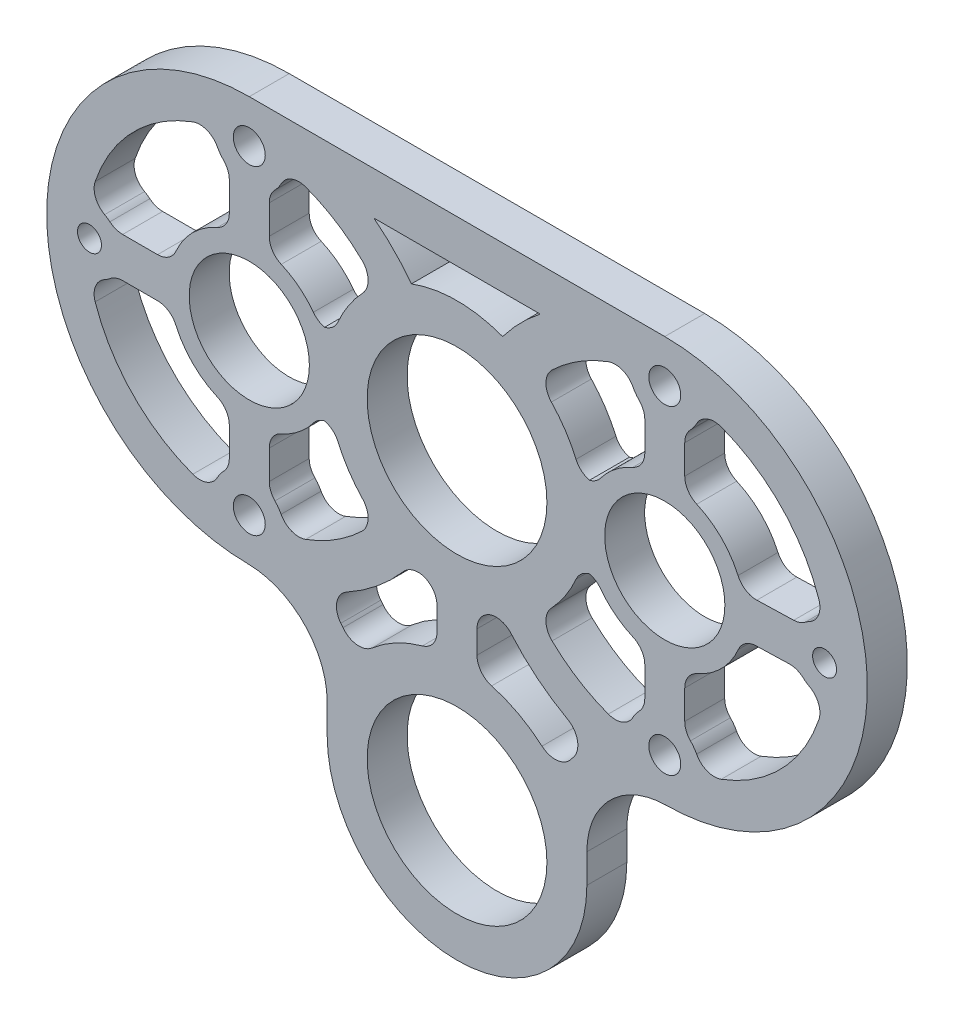
from build123d import *

# Parameters (mm, degrees)
SKETCH1_R           = 9.5504
SKETCH1_R_2         = 2.54
SKETCH1_R_3         = 14.2875
SKETCH1_R_4         = 1.905
BOSS_EXTRUDE1_DEPTH = 6.35
FILLET1_R           = 3.175
FILLET2_R           = 3.175


with BuildPart() as part:
    # Sketch1 → Boss-Extrude1 (new body)
    with BuildSketch(Plane.XY):
        with BuildLine():
            Line((-45.375096546, -115.411422013), (-45.375096546, -110.788622013))
            ThreePointArc((-45.375096546, -110.788622013), (-49.094840425, -101.808365892), (-58.075096546, -98.088622013))
            Line((-58.075096546, -98.088622013), (-57.757596546, -98.088622013))
            ThreePointArc((-57.757596546, -98.088622013), (-89.964796546, -65.881422013), (-57.757596546, -33.674222013))
            Line((-57.757596546, -33.674222013), (8.282403454, -33.674222013))
            ThreePointArc((8.282403454, -33.674222013), (40.489603454, -65.881422013), (8.282403454, -98.088622013))
            Line((8.282403454, -98.088622013), (8.599903454, -98.088622013))
            ThreePointArc((8.599903454, -98.088622013), (-0.380352667, -101.808365892), (-4.100096546, -110.788622013))
            Line((-4.100096546, -110.788622013), (-4.100096546, -115.411422013))
            ThreePointArc((-4.100096546, -115.411422013), (-24.737596546, -136.048922013), (-45.375096546, -115.411422013))
        make_face()
        with Locations((-57.757596546, -65.881422013)):
            Circle(SKETCH1_R, mode=Mode.SUBTRACT)
        with Locations((-57.757596546, -40.481422013)):
            Circle(SKETCH1_R_2, mode=Mode.SUBTRACT)
        with Locations((-24.737596546, -115.411422013)):
            Circle(SKETCH1_R_3, mode=Mode.SUBTRACT)
        with Locations((-57.757596546, -91.281422013)):
            Circle(SKETCH1_R_2, mode=Mode.SUBTRACT)
        with Locations((-24.737596546, -65.881422013)):
            Circle(SKETCH1_R_3, mode=Mode.SUBTRACT)
        with Locations((-83.157596546, -65.881422013)):
            Circle(SKETCH1_R_4, mode=Mode.SUBTRACT)
        with Locations((33.682403454, -65.881422013)):
            Circle(SKETCH1_R_4, mode=Mode.SUBTRACT)
        with Locations((8.282403454, -91.281422013)):
            Circle(SKETCH1_R_2, mode=Mode.SUBTRACT)
        with Locations((8.282403454, -40.481422013)):
            Circle(SKETCH1_R_2, mode=Mode.SUBTRACT)
        with Locations((8.282403454, -65.881422013)):
            Circle(SKETCH1_R, mode=Mode.SUBTRACT)
        with BuildLine():
            Line((-70.080549932, -62.706422013), (-79.192022817, -62.706422013))
            ThreePointArc((-79.192022817, -62.706422013), (-80.936874286, -61.312527985), (-83.110911346, -60.801636536))
            ThreePointArc((-83.110911346, -60.801636536), (-76.26856426, -47.827644953), (-63.469709832, -40.663044713))
            ThreePointArc((-63.469709832, -40.663044713), (-62.754302005, -43.255256823), (-60.932596546, -45.233326894))
            Line((-60.932596546, -45.233326894), (-60.932596546, -53.558468627))
            ThreePointArc((-60.932596546, -53.558468627), (-66.755813179, -56.88320538), (-70.080549932, -62.706422013))
        make_face(mode=Mode.SUBTRACT)
        with BuildLine():
            Line((-60.932596546, -86.529517132), (-60.932596546, -78.204375399))
            ThreePointArc((-60.932596546, -78.204375399), (-66.755813179, -74.879638646), (-70.080549932, -69.056422013))
            Line((-70.080549932, -69.056422013), (-79.192022817, -69.056422013))
            ThreePointArc((-79.192022817, -69.056422013), (-80.936874286, -70.450316041), (-83.110911346, -70.96120749))
            ThreePointArc((-83.110911346, -70.96120749), (-76.26856426, -83.935199073), (-63.469709832, -91.099799313))
            ThreePointArc((-63.469709832, -91.099799313), (-62.754302005, -88.507587203), (-60.932596546, -86.529517132))
        make_face(mode=Mode.SUBTRACT)
        with BuildLine():
            Line((-54.582596546, -45.233326894), (-54.582596546, -53.558468627))
            ThreePointArc((-54.582596546, -53.558468627), (-50.053751715, -55.75291867), (-46.729754275, -59.531422013))
            Line((-46.729754275, -59.531422013), (-44.373887088, -59.531422013))
            ThreePointArc((-44.373887088, -59.531422013), (-41.698150512, -54.123615439), (-37.572726988, -49.720796011))
            ThreePointArc((-37.572726988, -49.720796011), (-44.03993841, -43.962921903), (-52.04548326, -40.663044713))
            ThreePointArc((-52.04548326, -40.663044713), (-52.760891087, -43.255256823), (-54.582596546, -45.233326894))
        make_face(mode=Mode.SUBTRACT)
        with BuildLine():
            Line((-54.582596546, -86.529517132), (-54.582596546, -78.204375399))
            ThreePointArc((-54.582596546, -78.204375399), (-50.053751715, -76.009925356), (-46.729754275, -72.231422013))
            Line((-46.729754275, -72.231422013), (-44.373887088, -72.231422013))
            ThreePointArc((-44.373887088, -72.231422013), (-41.698150512, -77.639228587), (-37.572726988, -82.042048015))
            ThreePointArc((-37.572726988, -82.042048015), (-44.03993841, -87.799922123), (-52.04548326, -91.099799313))
            ThreePointArc((-52.04548326, -91.099799313), (-52.760891087, -88.507587203), (-54.582596546, -86.529517132))
        make_face(mode=Mode.SUBTRACT)
        with BuildLine():
            Line((-27.912596546, -86.273228732), (-27.912596546, -95.019615294))
            ThreePointArc((-27.912596546, -95.019615294), (-35.112263245, -97.571223104), (-40.890680375, -102.566800996))
            ThreePointArc((-40.890680375, -102.566800996), (-43.150056593, -98.950307843), (-46.157275539, -95.926992142))
            ThreePointArc((-46.157275539, -95.926992142), (-38.319238067, -91.561257516), (-31.989611604, -85.202775067))
            ThreePointArc((-31.989611604, -85.202775067), (-29.978505677, -85.842365822), (-27.912596546, -86.273228732))
        make_face(mode=Mode.SUBTRACT)
        with BuildLine():
            Line((-21.562596546, -86.273228732), (-21.562596546, -95.019615294))
            ThreePointArc((-21.562596546, -95.019615294), (-14.362929847, -97.571223104), (-8.584512718, -102.566800996))
            ThreePointArc((-8.584512718, -102.566800996), (-6.302122378, -98.921350797), (-3.26011532, -95.880823561))
            ThreePointArc((-3.26011532, -95.880823561), (-11.095136366, -91.527177673), (-17.423348009, -85.179302067))
            ThreePointArc((-17.423348009, -85.179302067), (-19.464527932, -85.833894382), (-21.562596546, -86.273228732))
        make_face(mode=Mode.SUBTRACT)
        with BuildLine():
            Line((-11.520215864, -40.481422013), (-37.954977229, -40.481422013))
            ThreePointArc((-37.954977229, -40.481422013), (-34.770481018, -43.32269307), (-31.989611604, -46.560068959))
            ThreePointArc((-31.989611604, -46.560068959), (-24.737596546, -45.243922013), (-17.485581488, -46.560068959))
            ThreePointArc((-17.485581488, -46.560068959), (-14.704712075, -43.32269307), (-11.520215864, -40.481422013))
        make_face(mode=Mode.SUBTRACT)
        with BuildLine():
            Line((-2.745438817, -72.231422013), (-5.101306004, -72.231422013))
            ThreePointArc((-5.101306004, -72.231422013), (-7.77704258, -77.639228587), (-11.902466104, -82.042048015))
            ThreePointArc((-11.902466104, -82.042048015), (-5.435254683, -87.799922123), (2.570290168, -91.099799313))
            ThreePointArc((2.570290168, -91.099799313), (3.285697995, -88.507587203), (5.107403454, -86.529517132))
            Line((5.107403454, -86.529517132), (5.107403454, -78.204375399))
            ThreePointArc((5.107403454, -78.204375399), (0.578558623, -76.009925356), (-2.745438817, -72.231422013))
        make_face(mode=Mode.SUBTRACT)
        with BuildLine():
            Line((20.60535684, -69.056422013), (29.522775563, -68.79756601))
            ThreePointArc((29.522775563, -68.79756601), (31.31732342, -70.377286383), (33.635718254, -70.96120749))
            ThreePointArc((33.635718254, -70.96120749), (26.793371168, -83.935199073), (13.99451674, -91.099799313))
            ThreePointArc((13.99451674, -91.099799313), (13.279108913, -88.507587203), (11.457403454, -86.529517132))
            Line((11.457403454, -86.529517132), (11.457403454, -78.204375399))
            ThreePointArc((11.457403454, -78.204375399), (17.280620087, -74.879638646), (20.60535684, -69.056422013))
        make_face(mode=Mode.SUBTRACT)
        with BuildLine():
            Line((-2.745438817, -59.531422013), (-5.101306004, -59.531422013))
            ThreePointArc((-5.101306004, -59.531422013), (-7.77704258, -54.123615439), (-11.902466104, -49.720796011))
            ThreePointArc((-11.902466104, -49.720796011), (-5.435254683, -43.962921903), (2.570290168, -40.663044713))
            ThreePointArc((2.570290168, -40.663044713), (3.285697995, -43.255256823), (5.107403454, -45.233326894))
            Line((5.107403454, -45.233326894), (5.107403454, -53.558468627))
            ThreePointArc((5.107403454, -53.558468627), (0.578558623, -55.75291867), (-2.745438817, -59.531422013))
        make_face(mode=Mode.SUBTRACT)
        with BuildLine():
            Line((11.457403454, -45.233326894), (11.457403454, -53.558468627))
            ThreePointArc((11.457403454, -53.558468627), (17.280620087, -56.88320538), (20.60535684, -62.706422013))
            Line((20.60535684, -62.706422013), (29.938737744, -62.44756601))
            ThreePointArc((29.938737744, -62.44756601), (31.616257049, -61.240577366), (33.635718254, -60.801636536))
            ThreePointArc((33.635718254, -60.801636536), (26.793371168, -47.827644953), (13.99451674, -40.663044713))
            ThreePointArc((13.99451674, -40.663044713), (13.279108913, -43.255256823), (11.457403454, -45.233326894))
        make_face(mode=Mode.SUBTRACT)
    extrude(amount=BOSS_EXTRUDE1_DEPTH)

    # Fillet1
    # the kernel refuses this fillet: 3.175 mm, written as the material it adds along each edge
    with BuildSketch(Plane(origin=(-63.469709832, -40.663044713, 0), x_dir=(0.2545165801786531, -0.9670684104106406, 0), z_dir=(0, 0, 1)), Plane(origin=(13.99451674, -91.099799313, 0), x_dir=(-0.25451658017866297, 0.967068410410638, 0), z_dir=(0, 0, 1)), Plane(origin=(2.570290168, -40.663044713, 0), x_dir=(0.25451658017865375, -0.9670684104106404, 0), z_dir=(0, 0, 1))) as fillet1_piece_1:
        with BuildLine():
            CenterArc((3.26647524, -3.094572391), FILLET1_R, 102.923775638, 82.642434377)
            ThreePointArc((0.106446076, -3.402534536), (-0.002832337, -1.703020924), (0, 0))
            ThreePointArc((0, 0), (1.278185963, -0.144769696), (2.556371927, 0))
        make_face()
    extrude(amount=6.35)
    with BuildSketch(Plane(origin=(-60.932596546, -45.233326894, 0), x_dir=(0, -1, 0), z_dir=(0, 0, 1)), Plane(origin=(11.457403454, -86.529517132, 0), x_dir=(0, 1, 0), z_dir=(0, 0, 1)), Plane(origin=(5.107403454, -45.233326894, 0), x_dir=(0, -1, 0), z_dir=(0, 0, 1)), Plane(origin=(-54.582596546, -86.529517132, 0), x_dir=(0, 1, 0), z_dir=(0, 0, 1))) as fillet1_piece_2:
        with BuildLine():
            CenterArc((1.469799065, -3.175), FILLET1_R, 90, 44.415308597)
            ThreePointArc((-0.752238058, -0.907142857), (-0.352674396, -0.473012628), (0, 0))
            Line((0, 0), (1.469799065, 0))
        make_face()
    extrude(amount=6.35)
    with BuildSketch(Plane(origin=(-60.932596546, -53.558468627, 0), x_dir=(-0.9455577058217259, -0.32545448984636016, 0), z_dir=(0, 0, 1)), Plane(origin=(11.457403454, -78.204375399, 0), x_dir=(0.9455577058217268, 0.3254544898463573, 0), z_dir=(0, 0, 1)), Plane(origin=(5.107403454, -53.558468627, 0), x_dir=(-0.9455577058217245, -0.3254544898463644, 0), z_dir=(0, 0, 1)), Plane(origin=(-54.582596546, -78.204375399, 0), x_dir=(0.9455577058217265, 0.32545448984635805, 0), z_dir=(0, 0, 1)), Plane(origin=(-70.080549932, -69.056422013, 0), x_dir=(0.325454489846357, -0.9455577058217269, 0), z_dir=(0, 0, 1))) as fillet1_piece_3:
        with BuildLine():
            CenterArc((2.26843008, -3.165015354), FILLET1_R, 94.545126593, 66.461761022)
            Line((-0.733715636, -2.131697349), (0, 0))
            ThreePointArc((0, 0), (1.008414792, -0.040018462), (2.016829583, 0))
        make_face()
    extrude(amount=6.35)
    with BuildSketch(Plane(origin=(-70.080549932, -62.706422013, 0), x_dir=(0.32545448984635805, 0.9455577058217265, 0), z_dir=(0, 0, 1)), Plane(origin=(5.107403454, -78.204375399, 0), x_dir=(-0.9455577058217269, 0.325454489846357, 0), z_dir=(0, 0, 1))) as fillet1_piece_4:
        with BuildLine():
            CenterArc((2.26843008, 3.165015354), FILLET1_R, 198.993112385, 66.461761022)
            Line((-0.733715636, 2.131697349), (0, 0))
            ThreePointArc((0, 0), (1.008414792, 0.040018462), (2.016829583, 0))
        make_face()
    extrude(amount=6.35)
    with BuildSketch(Plane(origin=(-5.101306004, -59.531422013, 0), x_dir=(-0.35427791260671704, 0.9351401823464905, 0), z_dir=(0, 0, 1)), Plane(origin=(-44.373887088, -72.231422013, 0), x_dir=(0.35427791260671626, -0.9351401823464908, 0), z_dir=(0, 0, 1))) as fillet1_piece_5:
        with BuildLine():
            CenterArc((2.193829867, -3.171130625), FILLET1_R, 92.828982669, 66.421821522)
            Line((-0.775240212, -2.046298253), (0, 0))
            ThreePointArc((0, 0), (1.018563867, -0.025150937), (2.037127733, 0))
        make_face()
    extrude(amount=6.35)
    with BuildSketch(Plane(origin=(-2.745438817, -59.531422013, 0), x_dir=(0.5500091242256826, 0.8351586455689107, 0), z_dir=(0, 0, 1))) as fillet1_piece_6:
        with BuildLine():
            CenterArc((1.714471741, 3.169300338), FILLET1_R, 213.367638931, 53.198716661)
            Line((-0.937156959, 1.423021368), (0, 0))
            ThreePointArc((0, 0), (0.76215647, 0.022844246), (1.524312941, 0))
        make_face()
    extrude(amount=6.35)
    with BuildSketch(Plane(origin=(-2.745438817, -72.231422013, 0), x_dir=(0.5500091242256772, -0.8351586455689144, 0), z_dir=(0, 0, 1)), Plane(origin=(-46.729754275, -59.531422013, 0), x_dir=(-0.5500091242256768, 0.8351586455689146, 0), z_dir=(0, 0, 1))) as fillet1_piece_7:
        with BuildLine():
            CenterArc((1.714471741, -3.169300338), FILLET1_R, 93.433644408, 53.198716661)
            Line((-0.937156959, -1.423021368), (0, 0))
            ThreePointArc((0, 0), (0.76215647, -0.022844246), (1.524312941, 0))
        make_face()
    extrude(amount=6.35)
    with BuildSketch(Plane(origin=(-5.101306004, -72.231422013, 0), x_dir=(1, 0, 0), z_dir=(0, 0, 1)), Plane(origin=(-44.373887088, -59.531422013, 0), x_dir=(-1, 0, 0), z_dir=(0, 0, 1))) as fillet1_piece_8:
        with BuildLine():
            CenterArc((2.188226205, -3.175), FILLET1_R, 90, 66.421821522)
            ThreePointArc((-0.721709361, -1.905), (-0.337335029, -0.961410421), (0, 0))
            Line((0, 0), (2.188226205, 0))
        make_face()
    extrude(amount=6.35)
    with BuildSketch(Plane(origin=(-11.902466104, -82.042048015, 0), x_dir=(0.736851809317772, 0.6760542959741662, 0), z_dir=(0, 0, 1))) as fillet1_piece_9:
        with BuildLine():
            CenterArc((3.161569482, -3.166958705), FILLET1_R, 94.078687757, 89.53308235)
            ThreePointArc((-0.00712436, -3.366969545), (-0.058423827, -1.683368687), (0, 0))
            ThreePointArc((0, 0), (1.467871545, -0.052268416), (2.93574309, 0))
        make_face()
    extrude(amount=6.35)
    with BuildSketch(Plane(origin=(2.570290168, -91.099799313, 0), x_dir=(-0.9586370257325714, 0.28463143342682545, 0), z_dir=(0, 0, 1)), Plane(origin=(13.99451674, -40.663044713, 0), x_dir=(0.9586370257325701, -0.2846314334268294, 0), z_dir=(0, 0, 1)), Plane(origin=(-63.469709832, -91.099799313, 0), x_dir=(-0.9586370257325711, 0.2846314334268262, 0), z_dir=(0, 0, 1)), Plane(origin=(-52.04548326, -40.663044713, 0), x_dir=(0.9586370257325701, -0.2846314334268294, 0), z_dir=(0, 0, 1))) as fillet1_piece_10:
        with BuildLine():
            CenterArc((3.195198736, -3.168113605), FILLET1_R, 86.225666688, 82.642434377)
            ThreePointArc((0.079935323, -2.55512187), (0.184666565, -1.273034124), (0, 0))
            ThreePointArc((0, 0), (1.702099588, 0.056082799), (3.404199176, 0))
        make_face()
    extrude(amount=6.35)
    with BuildSketch(Plane(origin=(5.107403454, -86.529517132, 0), x_dir=(-0.769769113805321, -0.638322419652773, 0), z_dir=(0, 0, 1)), Plane(origin=(-54.582596546, -45.233326894, 0), x_dir=(0.7697691138053148, 0.6383224196527804, 0), z_dir=(0, 0, 1))) as fillet1_piece_11:
        with BuildLine():
            CenterArc((1.50581124, -3.158079606), FILLET1_R, 95.917851403, 44.415308597)
            Line((-0.938205696, -1.131405924), (0, 0))
            ThreePointArc((0, 0), (0.589230485, -0.030456708), (1.178460971, 0))
        make_face()
    extrude(amount=6.35)
    with BuildSketch(Plane(origin=(20.60535684, -69.056422013, 0), x_dir=(-0.3233501926059157, -0.9462793736216156, 0), z_dir=(0, 0, 1))) as fillet1_piece_12:
        with BuildLine():
            CenterArc((2.204943646, 3.165567234), FILLET1_R, 200.528374335, 65.053959626)
            Line((-0.768439544, 2.052186166), (0, 0))
            ThreePointArc((0, 0), (0.98019234, 0.037806527), (1.960384679, 0))
        make_face()
    extrude(amount=6.35)
    with BuildSketch(Plane(origin=(11.457403454, -53.558468627, 0), x_dir=(0, 1, 0), z_dir=(0, 0, 1)), Plane(origin=(-60.932596546, -78.204375399, 0), x_dir=(0, -1, 0), z_dir=(0, 0, 1)), Plane(origin=(-54.582596546, -53.558468627, 0), x_dir=(0, 1, 0), z_dir=(0, 0, 1))) as fillet1_piece_13:
        with BuildLine():
            CenterArc((2.254433902, -3.175), FILLET1_R, 90, 66.461761022)
            ThreePointArc((-0.656386243, -1.907028754), (-0.290353357, -0.966538565), (0, 0))
            Line((0, 0), (2.254433902, 0))
        make_face()
    extrude(amount=6.35)
    with BuildSketch(Plane(origin=(20.60535684, -62.706422013, 0), x_dir=(-0.3274982784770333, 0.9448517754624688, 0), z_dir=(0, 0, 1))) as fillet1_piece_14:
        with BuildLine():
            CenterArc((2.330126786, -3.164463927), FILLET1_R, 94.669015537, 67.802641695)
            Line((-0.697451876, -2.20822523), (0, 0))
            ThreePointArc((0, 0), (1.035841633, -0.04222858), (2.071683265, 0))
        make_face()
    extrude(amount=6.35)
    with BuildSketch(Plane(origin=(11.457403454, -45.233326894, 0), x_dir=(0, -1, 0), z_dir=(0, 0, 1)), Plane(origin=(-60.932596546, -86.529517132, 0), x_dir=(0, 1, 0), z_dir=(0, 0, 1))) as fillet1_piece_15:
        with BuildLine():
            CenterArc((1.469799065, 3.175), FILLET1_R, 225.584691403, 44.415308597)
            ThreePointArc((-0.752238058, 0.907142857), (-0.352674396, 0.473012628), (0, 0))
            Line((0, 0), (1.469799065, 0))
        make_face()
    extrude(amount=6.35)
    with BuildSketch(Plane(origin=(-11.902466104, -49.720796011, 0), x_dir=(0.6744936398427407, 0.7382806578881037, 0), z_dir=(0, 0, 1)), Plane(origin=(-37.572726988, -82.042048015, 0), x_dir=(-0.6744936398427365, -0.7382806578881076, 0), z_dir=(0, 0, 1))) as fillet1_piece_16:
        with BuildLine():
            CenterArc((3.160261888, -3.168263535), FILLET1_R, 86.266994712, 89.53308235)
            ThreePointArc((-0.00621189, -2.935736518), (0.049162354, -1.467978857), (0, 0))
            ThreePointArc((0, 0), (1.683488541, 0.054861769), (3.366977082, 0))
        make_face()
    extrude(amount=6.35)
    with BuildSketch(Plane(origin=(-46.729754275, -72.231422013, 0), x_dir=(1, 0, 0), z_dir=(0, 0, 1))) as fillet1_piece_17:
        with BuildLine():
            CenterArc((1.703893477, -3.175), FILLET1_R, 90, 53.198716661)
            ThreePointArc((-0.838386026, -1.273043131), (-0.400114443, -0.649086109), (0, 0))
            Line((0, 0), (1.703893477, 0))
        make_face()
    extrude(amount=6.35)
    with BuildSketch(Plane(origin=(-52.04548326, -91.099799313, 0), x_dir=(0.9586370257325715, 0.284631433426825, 0), z_dir=(0, 0, 1))) as fillet1_piece_18:
        with BuildLine():
            CenterArc((3.195198736, 3.168113605), FILLET1_R, 191.131898935, 82.642434377)
            ThreePointArc((0.079935323, 2.55512187), (0.184666565, 1.273034124), (0, 0))
            ThreePointArc((0, 0), (1.702099588, -0.056082799), (3.404199176, 0))
        make_face()
    extrude(amount=6.35)
    with BuildSketch(Plane(origin=(-37.572726988, -49.720796011, 0), x_dir=(-0.6744936398427409, 0.7382806578881034, 0), z_dir=(0, 0, 1))) as fillet1_piece_19:
        with BuildLine():
            CenterArc((3.160261888, 3.168263535), FILLET1_R, 184.199922939, 89.53308235)
            ThreePointArc((-0.00621189, 2.935736518), (0.049162354, 1.467978857), (0, 0))
            ThreePointArc((0, 0), (1.683488541, -0.054861769), (3.366977082, 0))
        make_face()
    extrude(amount=6.35)
    with BuildSketch(Plane(origin=(33.635718254, -70.96120749, 0), x_dir=(-0.25898004435492405, -0.9658826722878517, 0), z_dir=(0, 0, 1)), Plane(origin=(-83.110911346, -60.801636536, 0), x_dir=(0.2589800443549182, 0.9658826722878534, 0), z_dir=(0, 0, 1))) as fillet1_piece_20:
        with BuildLine():
            CenterArc((3.115278824, -3.16845414), FILLET1_R, 86.320203896, 80.387477763)
            ThreePointArc((0.025338004, -2.438460487), (0.161158466, -1.217687292), (0, 0))
            ThreePointArc((0, 0), (1.65952582, 0.053309481), (3.319051641, 0))
        make_face()
    extrude(amount=6.35)
    with BuildSketch(Plane(origin=(29.522775563, -68.79756601, 0), x_dir=(0.6626642457955191, -0.7489166157485464, 0), z_dir=(0, 0, 1))) as fillet1_piece_21:
        with BuildLine():
            CenterArc((1.502780962, -3.154774253), FILLET1_R, 96.470664285, 43.688676976)
            Line((-0.935076398, -1.120695471), (0, 0))
            ThreePointArc((0, 0), (0.572487986, -0.032361195), (1.144975971, 0))
        make_face()
    extrude(amount=6.35)
    with BuildSketch(Plane(origin=(29.938737744, -62.44756601, 0), x_dir=(-0.9996156224182043, -0.027723769899962433, 0), z_dir=(0, 0, 1))) as fillet1_piece_22:
        with BuildLine():
            CenterArc((1.159545983, -3.175), FILLET1_R, 90, 35.609801442)
            ThreePointArc((-0.689136047, -0.593721295), (-0.33125235, -0.312316233), (0, 0))
            Line((0, 0), (1.159545983, 0))
        make_face()
    extrude(amount=6.35)
    with BuildSketch(Plane(origin=(33.635718254, -60.801636536, 0), x_dir=(-0.9685214443924736, -0.24893013427850902, 0), z_dir=(0, 0, 1)), Plane(origin=(-83.110911346, -70.96120749, 0), x_dir=(0.9685214443924745, 0.24893013427850633, 0), z_dir=(0, 0, 1))) as fillet1_piece_23:
        with BuildLine():
            CenterArc((3.200652167, -3.082189075), FILLET1_R, 103.887656457, 80.387477763)
            ThreePointArc((0.034486352, -3.318872472), (-0.036063428, -1.659990144), (0, 0))
            ThreePointArc((0, 0), (1.219296064, -0.14849748), (2.438592127, 0))
        make_face()
    extrude(amount=6.35)
    with BuildSketch(Plane(origin=(-79.192022817, -69.056422013, 0), x_dir=(1, 0, 0), z_dir=(0, 0, 1))) as fillet1_piece_24:
        with BuildLine():
            CenterArc((1.309132424, -3.175), FILLET1_R, 90, 39.715137232)
            ThreePointArc((-0.719600712, -0.732692308), (-0.341237773, -0.384577064), (0, 0))
            Line((0, 0), (1.309132424, 0))
        make_face()
    extrude(amount=6.35)
    with BuildSketch(Plane(origin=(-79.192022817, -62.706422013, 0), x_dir=(-0.7007041465370244, 0.7134519598584197, 0), z_dir=(0, 0, 1))) as fillet1_piece_25:
        with BuildLine():
            CenterArc((1.347895455, -3.158738759), FILLET1_R, 95.801337657, 39.715137232)
            Line((-0.917314518, -0.934003094), (0, 0))
            ThreePointArc((0, 0), (0.513483983, -0.026017986), (1.026967965, 0))
        make_face()
    extrude(amount=6.35)

    # Fillet2
    # the kernel refuses this fillet: 3.175 mm, written as the material it adds along each edge
    with BuildSketch(Plane(origin=(-46.157275539, -95.926992142, 0), x_dir=(0.906740920626884, 0.42168815831217116, 0), z_dir=(0, 0, 1))) as fillet2_piece_1:
        with BuildLine():
            CenterArc((4.514834301, -3.167908707), FILLET2_R, 93.830093313, 99.918755619)
            ThreePointArc((1.430808069, -3.922499457), (0.823193542, -1.921931407), (0, 0))
            ThreePointArc((0, 0), (2.151375383, -0.071934079), (4.302750766, 0))
        make_face()
    extrude(amount=6.35)
    with BuildSketch(Plane(origin=(-40.890680375, -102.566800996, 0), x_dir=(0.6921197732298235, 0.7217826677777028, 0), z_dir=(0, 0, 1))) as fillet2_piece_2:
        with BuildLine():
            CenterArc((4.111356075, 3.161389558), FILLET2_R, 170.804753319, 93.888148142)
            ThreePointArc((0.977156331, 3.668752314), (0.580203711, 1.809972089), (0, 0))
            ThreePointArc((0, 0), (1.908843892, 0.088467876), (3.817687783, 0))
        make_face()
    extrude(amount=6.35)
    with BuildSketch(Plane(origin=(-27.912596546, -95.019615294, 0), x_dir=(-0.9775707373939293, -0.21060734410530216, 0), z_dir=(0, 0, 1)), Plane(origin=(-21.562596546, -86.273228732, 0), x_dir=(0.9775707373939305, 0.21060734410529677, 0), z_dir=(0, 0, 1))) as fillet2_piece_3:
        with BuildLine():
            CenterArc((2.564966198, -3.169709515), FILLET2_R, 93.308063427, 74.533990047)
            Line((-0.538820893, -2.501031198), (0, 0))
            ThreePointArc((0, 0), (1.190877163, -0.034388152), (2.381754327, 0))
        make_face()
    extrude(amount=6.35)
    with BuildSketch(Plane(origin=(-8.584512718, -102.566800996, 0), x_dir=(-0.6921197732298222, 0.721782667777704, 0), z_dir=(0, 0, 1))) as fillet2_piece_4:
        with BuildLine():
            CenterArc((4.111356075, -3.161389558), FILLET2_R, 95.307098539, 93.888148142)
            ThreePointArc((0.977156331, -3.668752314), (0.580203711, -1.809972089), (0, 0))
            ThreePointArc((0, 0), (1.908843892, -0.088467876), (3.817687783, 0))
        make_face()
    extrude(amount=6.35)
    with BuildSketch(Plane(origin=(-3.26011532, -95.880823561, 0), x_dir=(-0.9070525489910526, 0.4210174264431747, 0), z_dir=(0, 0, 1))) as fillet2_piece_5:
        with BuildLine():
            CenterArc((4.534615604, 3.167819214), FILLET2_R, 166.041580433, 100.104224994)
            ThreePointArc((1.453370061, 3.933685327), (0.83525797, 1.926728458), (0, 0))
            ThreePointArc((0, 0), (2.160599759, 0.072697444), (4.321199518, 0))
        make_face()
    extrude(amount=6.35)
    with BuildSketch(Plane(origin=(-21.562596546, -95.019615294, 0), x_dir=(0, 1, 0), z_dir=(0, 0, 1)), Plane(origin=(-27.912596546, -86.273228732, 0), x_dir=(0, -1, 0), z_dir=(0, 0, 1))) as fillet2_piece_6:
        with BuildLine():
            CenterArc((2.558414549, -3.175), FILLET2_R, 90, 74.533990047)
            ThreePointArc((-0.501614953, -2.328333333), (-0.217190626, -1.171409064), (0, 0))
            Line((0, 0), (2.558414549, 0))
        make_face()
    extrude(amount=6.35)
    with BuildSketch(Plane(origin=(-17.423348009, -85.179302067, 0), x_dir=(0.625968597717138, -0.779848263877044, 0), z_dir=(0, 0, 1))) as fillet2_piece_7:
        with BuildLine():
            CenterArc((2.186032815, -3.173332649), FILLET2_R, 91.856941767, 64.501343948)
            ThreePointArc((-0.722492648, -1.900106577), (-0.337836632, -0.958954542), (0, 0))
            ThreePointArc((0, 0), (1.04157494, -0.016880068), (2.083149879, 0))
        make_face()
    extrude(amount=6.35)
    with BuildSketch(Plane(origin=(-31.989611604, -85.202775067, 0), x_dir=(0.9523579585846875, -0.3049824892029156, 0), z_dir=(0, 0, 1))) as fillet2_piece_8:
        with BuildLine():
            CenterArc((2.183655184, -3.171166455), FILLET2_R, 92.815851636, 64.380507539)
            ThreePointArc((-0.743182134, -1.940618481), (-0.355935542, -0.976304704), (0, 0))
            ThreePointArc((0, 0), (1.013839907, -0.024918044), (2.027679813, 0))
        make_face()
    extrude(amount=6.35)


solid = part.part
